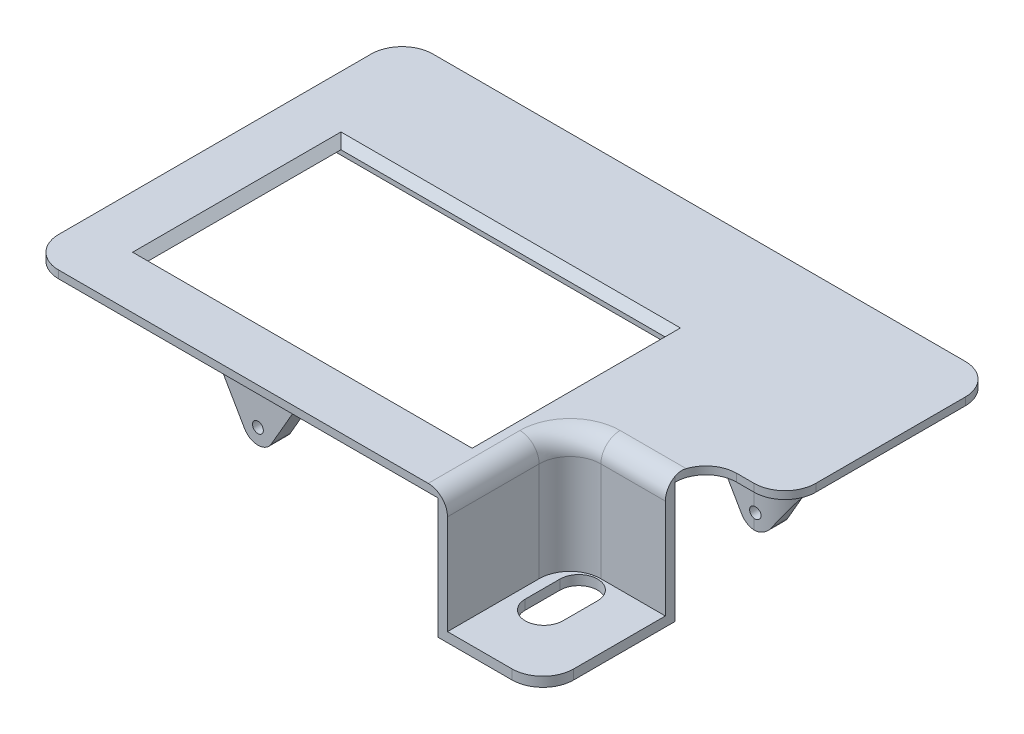
from build123d import *

# Parameters (mm, degrees)
BOSS_EXTRUDE1_DEPTH = 2
BOSS_EXTRUDE2_DEPTH = 2
SKETCH3_W           = 27.22
SKETCH3_H           = 33.28
BOSS_EXTRUDE3_DEPTH = 2.5
SKETCH4_W           = 31.75
SKETCH4_H           = 33.28
BOSS_EXTRUDE4_DEPTH = 2.5
SKETCH5_W           = 27.22
SKETCH5_H           = 34.25
BOSS_EXTRUDE5_DEPTH = 2.5
FILLET1_R           = 8
CUT_EXTRUDE1_REACH  = 98.066
FILLET3_R           = 8
FILLET6_R           = 5
SKETCH7_W           = 101
SKETCH7_H           = 62.8
SKETCH7_W_2         = 97
SKETCH7_H_2         = 58.8
BOSS_EXTRUDE6_DEPTH = 6
CUT_EXTRUDE2_REACH  = 98.896
SKETCH8_W           = 84
SKETCH8_H           = 50
CHAMFER1_SIZE       = 2
BOSS_EXTRUDE7_START = -2.5
SKETCH9_R           = 1.4
BOSS_EXTRUDE7_DEPTH = 5
BOSS_EXTRUDE8_START = 3.75
SKETCH10_R          = 1.4
BOSS_EXTRUDE8_DEPTH = 5
SKETCH11_R          = 1.4
BOSS_EXTRUDE9_DEPTH = 5
CUT_EXTRUDE3_DEPTH  = 97.22727472
SKETCH13_W          = 2
SKETCH13_H          = 5
CUT_EXTRUDE4_DEPTH  = 6


with BuildPart() as part:
    # Sketch1 → Boss-Extrude1 (new body)
    with BuildSketch(Plane(origin=(0, 0, 0), x_dir=(1, 0, 0), z_dir=(0, 1, 0))):
        with BuildLine():
            Line((-77, 40.5), (-77, -40.5))
            ThreePointArc((-77, -40.5), (-74.656854249, -46.156854249), (-69, -48.5))
            Line((-69, -48.5), (29.28, -48.5))
            Line((29.28, -48.5), (29.28, -46))
            Line((29.28, -46), (29.28, -14.25))
            Line((29.28, -14.25), (54, -14.25))
            Line((54, -14.25), (56.5, -14.25))
            ThreePointArc((56.5, -14.25), (58.843145751, -8.593145751), (64.5, -6.25))
            Line((64.5, -6.25), (69, -6.25))
            ThreePointArc((69, -6.25), (74.656854249, -3.906854249), (77, 1.75))
            Line((77, 1.75), (77, 40.5))
            ThreePointArc((77, 40.5), (74.656854249, 46.156854249), (69, 48.5))
            Line((69, 48.5), (-69, 48.5))
            ThreePointArc((-69, 48.5), (-74.656854249, 46.156854249), (-77, 40.5))
        make_face()
    extrude(amount=BOSS_EXTRUDE1_DEPTH)

    # Sketch2 → Boss-Extrude2 (add)
    with BuildSketch(Plane.XZ):
        with BuildLine():
            Line((54, 11.75), (54, 14.25))
            Line((54, 14.25), (52, 14.25))
            Line((52, 14.25), (52, 11.75))
            ThreePointArc((52, 11.75), (54.928932188, 4.678932188), (62, 1.75))
            Line((62, 1.75), (66.5, 1.75))
            ThreePointArc((66.5, 1.75), (70.742640687, -0.007359313), (72.5, -4.25))
            Line((72.5, -4.25), (72.5, -38))
            ThreePointArc((72.5, -38), (70.742640687, -42.242640687), (66.5, -44))
            Line((66.5, -44), (-66.5, -44))
            ThreePointArc((-66.5, -44), (-70.742640687, -42.242640687), (-72.5, -38))
            Line((-72.5, -38), (-72.5, 38))
            ThreePointArc((-72.5, 38), (-70.742640687, 42.242640687), (-66.5, 44))
            Line((-66.5, 44), (29.28, 44))
            Line((29.28, 44), (29.28, 46))
            Line((29.28, 46), (-66.5, 46))
            ThreePointArc((-66.5, 46), (-72.156854249, 43.656854249), (-74.5, 38))
            Line((-74.5, 38), (-74.5, -38))
            ThreePointArc((-74.5, -38), (-72.156854249, -43.656854249), (-66.5, -46))
            Line((-66.5, -46), (66.5, -46))
            ThreePointArc((66.5, -46), (72.156854249, -43.656854249), (74.5, -38))
            Line((74.5, -38), (74.5, -4.25))
            ThreePointArc((74.5, -4.25), (72.156854249, 1.406854249), (66.5, 3.75))
            Line((66.5, 3.75), (62, 3.75))
            ThreePointArc((62, 3.75), (56.343145751, 6.093145751), (54, 11.75))
        make_face()
    extrude(amount=BOSS_EXTRUDE2_DEPTH)

    # Sketch3 → Boss-Extrude3 (add)
    with BuildSketch(Plane.XY.offset(14.25)):
        with Locations((42.89, -14.64)):
            Rectangle(SKETCH3_W, SKETCH3_H)
    extrude(amount=BOSS_EXTRUDE3_DEPTH)

    # Sketch4 → Boss-Extrude4 (add)
    with BuildSketch(Plane(origin=(29.28, 0, 0), x_dir=(0, 0, -1), z_dir=(1, 0, 0))):
        with Locations((-32.625, -14.64)):
            Rectangle(SKETCH4_W, SKETCH4_H)
    extrude(amount=BOSS_EXTRUDE4_DEPTH)

    # Sketch5 → Boss-Extrude5 (add)
    with BuildSketch(Plane.XZ.offset(31.28)):
        with Locations((42.89, 31.375)):
            Rectangle(SKETCH5_W, SKETCH5_H)
    extrude(amount=-BOSS_EXTRUDE5_DEPTH)

    # Fillet1
    fillet1_edges = [part.edges().sort_by_distance(p)[0] for p in [
        (56.5, -30.03, 48.5),
    ]]
    fillet(fillet1_edges, radius=FILLET1_R)

    # Sketch6 → Cut-Extrude1 (cut, up to next)
    with BuildSketch(Plane(origin=(0, -28.78, 0), x_dir=(1, 0, 0), z_dir=(0, 1, 0)), mode=Mode.PRIVATE) as cut_extrude1_sk1:
        with BuildLine():
            Line((44.31, -22.12), (44.31, -31.12))
            ThreePointArc((44.31, -31.12), (39.43, -36), (34.55, -31.12))
            Line((34.55, -31.12), (34.55, -22.12))
            ThreePointArc((34.55, -22.12), (39.43, -17.24), (44.31, -22.12))
        make_face()
    cut_extrude1_tool1 = extrude(cut_extrude1_sk1.sketch, amount=-CUT_EXTRUDE1_REACH, mode=Mode.PRIVATE) & part.part
    add(cut_extrude1_tool1.solids().sort_by_distance((39.43, -28.78, 26.62))[0], mode=Mode.SUBTRACT)

    # Fillet3
    fillet3_edges = [part.edges().sort_by_distance(p)[0] for p in [
        (29.28, -15.64, 14.25),
        (31.78, -13.39, 16.75),
    ]]
    fillet(fillet3_edges, radius=FILLET3_R)

    # Fillet6
    fillet6_edges = [part.edges().sort_by_distance(p)[0] for p in [
        (31.78, 2, 36.625),
        (34.123145751, 2, 19.093145751),
        (48.14, 2, 16.75),
    ]]
    fillet(fillet6_edges, radius=FILLET6_R)

    # Sketch7 → Boss-Extrude6 (add)
    with BuildSketch(Plane.XZ):
        with Locations((-21.12, 7.52)):
            Rectangle(SKETCH7_W, SKETCH7_H)
        with Locations((-21.12, 7.52)):
            Rectangle(SKETCH7_W_2, SKETCH7_H_2, mode=Mode.SUBTRACT)
    extrude(amount=BOSS_EXTRUDE6_DEPTH)

    # Sketch8 → Cut-Extrude2 (cut, up to next)
    with BuildSketch(Plane(origin=(0, 2, 0), x_dir=(1, 0, 0), z_dir=(0, 1, 0)), mode=Mode.PRIVATE) as cut_extrude2_sk1:
        with Locations((-19.42, -7.92)):
            Rectangle(SKETCH8_W, SKETCH8_H)
    cut_extrude2_tool1 = extrude(cut_extrude2_sk1.sketch, amount=-CUT_EXTRUDE2_REACH, mode=Mode.PRIVATE) & part.part
    add(cut_extrude2_tool1.solids().sort_by_distance((-19.42, 2, 7.92))[0], mode=Mode.SUBTRACT)

    # Chamfer1
    chamfer1_edges = [part.edges().sort_by_distance(p)[0] for p in [
        (-19.42, 2, 32.92),
        (-61.42, 2, 7.92),
        (-19.42, 2, -17.08),
        (22.58, 2, 7.92),
    ]]
    chamfer(chamfer1_edges, length=CHAMFER1_SIZE - 0.0001)  # a hair under: the kernel refuses the full size

    # Sketch9 → Boss-Extrude7 (add)
    with BuildSketch(Plane.XY.offset(48.5).offset(BOSS_EXTRUDE7_START)):
        with BuildLine():
            Line((-23.324101615, -12), (-30.252304845, 0))
            Line((-30.252304845, 0), (-9.467695155, 0))
            Line((-9.467695155, 0), (-16.395898385, -12))
            ThreePointArc((-16.395898385, -12), (-19.86, -14), (-23.324101615, -12))
        make_face()
        with Locations(Location((-19.86, -10, 0), (0, 0, 180))):
            Circle(SKETCH9_R, mode=Mode.SUBTRACT)
    extrude(amount=-BOSS_EXTRUDE7_DEPTH)

    # Sketch10 → Boss-Extrude8 (add)
    with BuildSketch(Plane.XY.offset(BOSS_EXTRUDE8_START)):
        with BuildLine():
            Line((70.214101615, -9), (75.410254038, 0))
            Line((75.410254038, 0), (58.089745962, 0))
            Line((58.089745962, 0), (63.285898385, -9))
            ThreePointArc((63.285898385, -9), (66.75, -11), (70.214101615, -9))
        make_face()
        with Locations(Location((66.75, -7, 0), (0, 0, 180))):
            Circle(SKETCH10_R, mode=Mode.SUBTRACT)
    extrude(amount=-BOSS_EXTRUDE8_DEPTH)

    # Sketch11 → Boss-Extrude9 (add)
    # profile 1 of 2: a face of its own
    with BuildSketch(Plane(origin=(0, 0, -46), x_dir=(-1, 0, 0), z_dir=(0, 0, -1))):
        with BuildLine():
            Line((-65.464101615, -9), (-70.660254038, 0))
            Line((-70.660254038, 0), (-53.339745962, 0))
            Line((-53.339745962, 0), (-58.535898385, -9))
            ThreePointArc((-58.535898385, -9), (-62, -11), (-65.464101615, -9))
        make_face()
        with Locations((-62, -7)):
            Circle(SKETCH11_R, mode=Mode.SUBTRACT)
    # profile 2 of 2: a face of its own
    with BuildSketch(Plane(origin=(0, 0, -46), x_dir=(-1, 0, 0), z_dir=(0, 0, -1))):
        with BuildLine():
            Line((58.535898385, -9), (53.339745962, 0))
            Line((53.339745962, 0), (70.660254038, 0))
            Line((70.660254038, 0), (65.464101615, -9))
            ThreePointArc((65.464101615, -9), (62, -11), (58.535898385, -9))
        make_face()
        with Locations((62, -7)):
            Circle(SKETCH11_R, mode=Mode.SUBTRACT)
    extrude(amount=-BOSS_EXTRUDE9_DEPTH)

    # Sketch12 → Cut-Extrude3 (cut, through all)
    with BuildSketch(Plane.XZ):
        with BuildLine():
            Line((-66.5, -46), (66.5, -46))
            ThreePointArc((66.5, -46), (72.156854249, -43.656854249), (74.5, -38))
            Line((74.5, -38), (84.295668918, -38))
            Line((84.295668918, -38), (84.295668918, -62.929633478))
            Line((84.295668918, -62.929633478), (-82.125682446, -61.467965399))
            Line((-82.125682446, -61.467965399), (-82.125682446, -38))
            Line((-82.125682446, -38), (-74.5, -38))
            ThreePointArc((-74.5, -38), (-72.156854249, -43.656854249), (-66.5, -46))
        make_face()
        with BuildLine():
            Line((66.5, 3.75), (62, 3.75))
            ThreePointArc((62, 3.75), (56.343145751, 6.093145751), (54, 11.75))
            Line((54, 11.75), (84.295668918, 11.75))
            Line((84.295668918, 11.75), (84.295668918, -4.25))
            Line((84.295668918, -4.25), (74.5, -4.25))
            ThreePointArc((74.5, -4.25), (72.156854249, 1.406854249), (66.5, 3.75))
        make_face()
    extrude(amount=CUT_EXTRUDE3_DEPTH, mode=Mode.SUBTRACT)

    # Sketch13 → Cut-Extrude4 (cut)
    with BuildSketch(Plane.XZ.offset(6)):
        with Locations((-70.62, 19.72)):
            Rectangle(SKETCH13_W, SKETCH13_H)
        with Locations((-70.62, -4.68)):
            Rectangle(SKETCH13_W, SKETCH13_H)
    extrude(amount=-CUT_EXTRUDE4_DEPTH, mode=Mode.SUBTRACT)


solid = part.part
